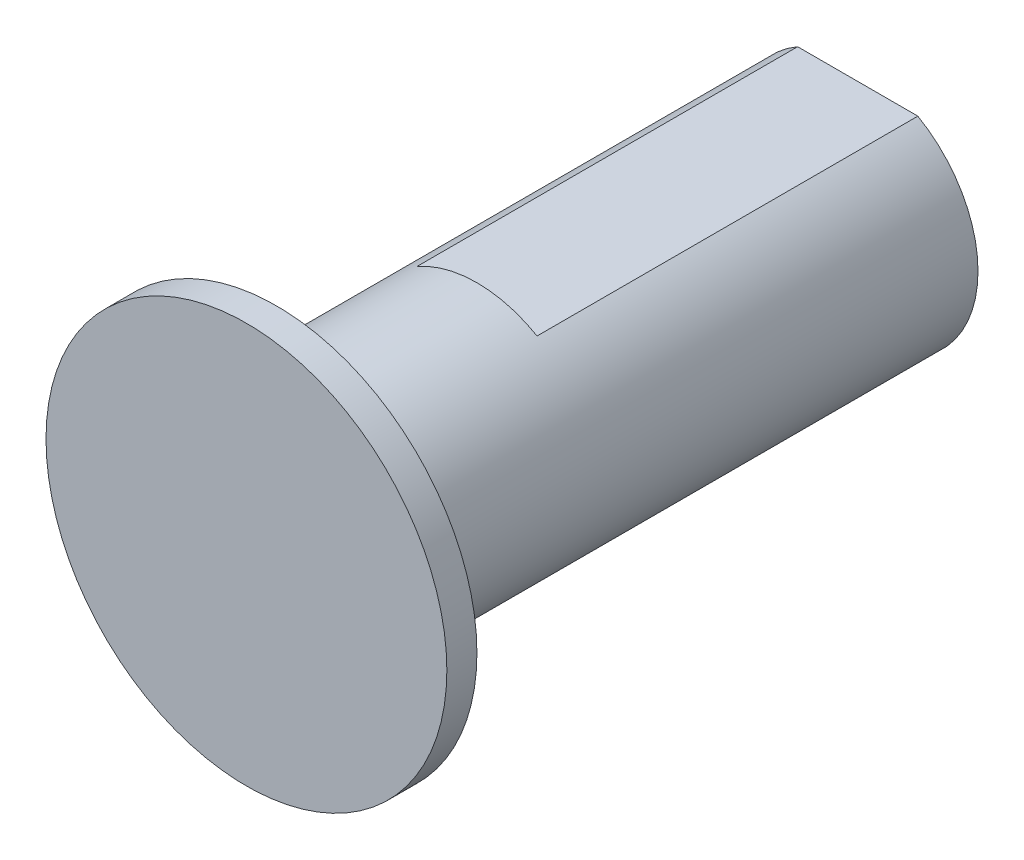
from build123d import *

# Parameters (mm, degrees)
SKETCH1_R           = 6
BOSS_EXTRUDE1_DEPTH = 29
CUT_EXTRUDE1_DEPTH  = 19
SKETCH3_R           = 10
BOSS_EXTRUDE2_DEPTH = 1.5


with BuildPart() as part:
    # Sketch1 → Boss-Extrude1 (new body)
    with BuildSketch(Plane.XY):
        Circle(SKETCH1_R)
    extrude(amount=BOSS_EXTRUDE1_DEPTH)

    # Sketch2 → Cut-Extrude1 (cut)
    with BuildSketch(Plane(origin=(0, 0, 0), x_dir=(-1, 0, 0), z_dir=(0, 0, -1))):
        with BuildLine():
            ThreePointArc((3, 5.196152423), (0, 6), (-3, 5.196152423))
            Line((-3, 5.196152423), (3, 5.196152423))
        make_face()
    extrude(amount=-CUT_EXTRUDE1_DEPTH, mode=Mode.SUBTRACT)

    # Sketch3 → Boss-Extrude2 (add)
    with BuildSketch(Plane.XY.offset(29)):
        Circle(SKETCH3_R)
    extrude(amount=BOSS_EXTRUDE2_DEPTH)


solid = part.part
